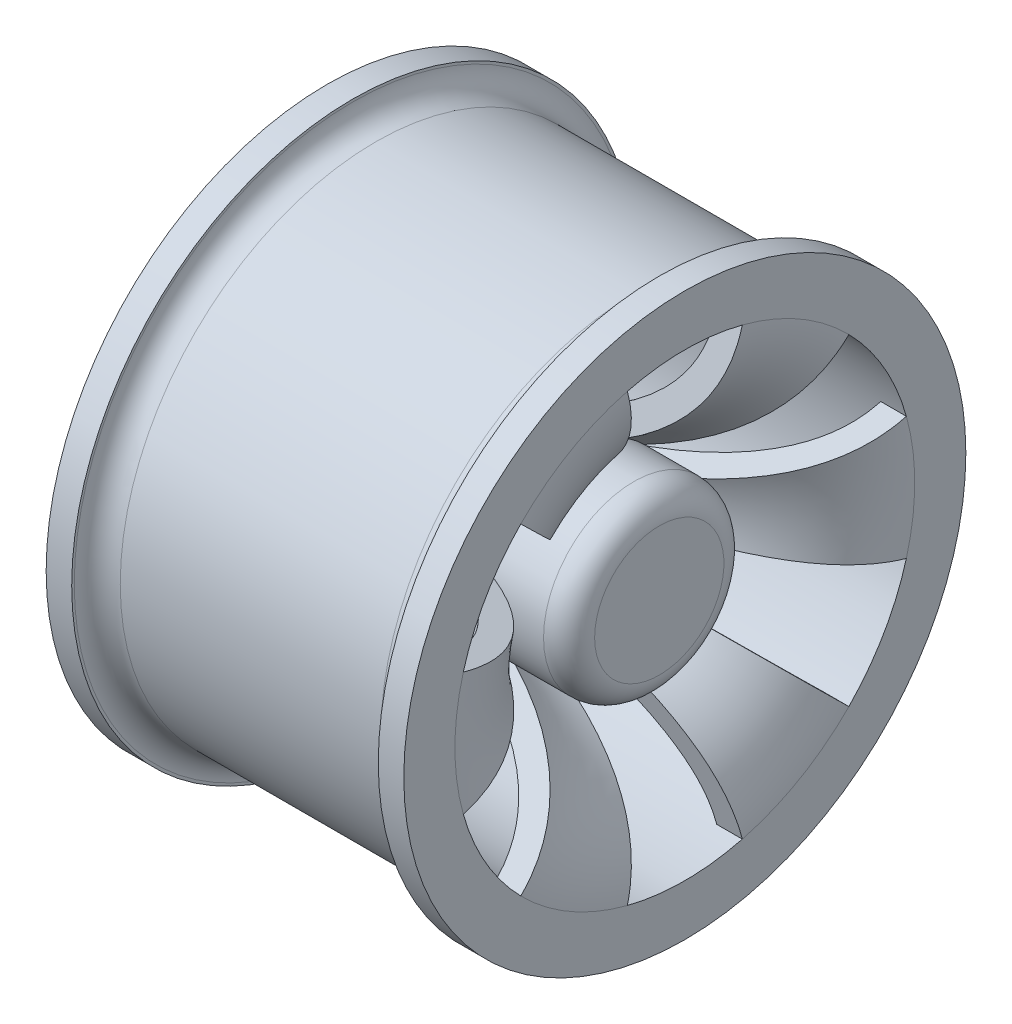
from build123d import *
from build123d.topology import SkipClean

# Parameters (mm, degrees)
REVOLVE1_OUTLINE_W  = 1
REVOLVE1_OUTLINE_H  = 1
SKETCH2_R           = 3.530343639
SKETCH2_R_2         = 2.5
BOSS_EXTRUDE1_DEPTH = 13
BOSS_EXTRUDE2_START = -2
SKETCH3_R           = 3.530343639
BOSS_EXTRUDE2_DEPTH = 2
CUT_EXTRUDE1_DEPTH  = 21.928449536
CIRPATTERN1_COUNT   = 6
FILLET1_R           = 1


# Read off the part's stored shape, not the designer's step: Revolve1
with BuildPart() as part:
    # Revolve1 outline → Revolve1 (revolve)
    with BuildSketch(Plane.YX):
        with BuildLine():
            add(Edge.make_bspline(
                [(2.5, 0), (2.716234195, 0.906371087), (3.054671918, 1.91746682), (3.530343639, 2.883101851)],
                knots=[0, 0, 0, 0, 0.307599927, 0.307599927, 0.307599927, 0.307599927], degree=3))
            Line((2.5, 0), (3.530343639, 0))
            Line((3.530343639, 0), (3.530343639, 2.883101851))
        make_face()
        with BuildLine():
            add(Edge.make_bspline(
                [(3.530343639, 2.883101851), (4.125497218, 4.091290439), (4.935485854, 5.228311877), (5.989749537, 6)],
                knots=[0.307599927, 0.307599927, 0.307599927, 0.307599927, 0.692464509, 0.692464509, 0.692464509, 0.692464509], degree=3))
            Line((3.530343639, 2.883101851), (3.530343639, 0))
            add(Edge.make_bspline(
                [(9, 6), (8.813858726, 5.999997286), (8.43297149, 5.974351341), (7.749922349, 5.831183314), (6.653568172, 5.361217178), (5.311352408, 4.099132984), (4.3155593, 2.31932682), (3.78420775, 0.901212892), (3.601875729, 0.278067654), (3.530343639, 0)],
                knots=[0, 0, 0, 0, 0.0625, 0.125, 0.25, 0.5, 0.75, 0.875, 0.972909743, 0.972909743, 0.972909743, 0.972909743], degree=3))
            Line((9, 6), (5.989749537, 6))
        make_face()
        with BuildLine():
            add(Edge.make_bspline(
                [(5.989749537, 6), (6.832184813, 6.616636338), (7.830594626, 7), (9, 7)],
                knots=[0.692464509, 0.692464509, 0.692464509, 0.692464509, 1, 1, 1, 1], degree=3))
            Line((5.989749537, 6), (9, 6))
            Line((9, 6), (9, 7))
        make_face()
        Polygon((10, 6), (9, 6), (9, 0), (10, 0), (10, 5.1), align=None)
        with Locations((9.5, 6.5)):
            Rectangle(REVOLVE1_OUTLINE_W, REVOLVE1_OUTLINE_H)
        Polygon((10, 0), (9, 0), (9, -7), (10, -7), (10, -5.1), align=None)
        with BuildLine():
            Line((10.9, 6), (10, 6))
            Line((10, 6), (10, 5.1))
            ThreePointArc((10, 5.1), (10.263603897, 5.736396103), (10.9, 6))
        make_face()
        Polygon((10, 7), (10, 6), (10.9, 6), (11, 6), (11, 7), align=None)
        with BuildLine():
            Line((10, -5.1), (10, -7))
            Line((10, -7), (11, -7))
            Line((11, -7), (11, -6))
            Line((11, -6), (10.9, -6))
            ThreePointArc((10.9, -6), (10.263603897, -5.736396103), (10, -5.1))
        make_face()
    revolve(axis=Axis((0, 0, 0), (1, 0, 0)))

    # Sketch2 → Boss-Extrude1 (add)
    with BuildSketch(Plane.ZY.offset(7)):
        Circle(SKETCH2_R)
        Circle(SKETCH2_R_2, mode=Mode.SUBTRACT)
    extrude(amount=-BOSS_EXTRUDE1_DEPTH)

    # Sketch3 → Boss-Extrude2 (add)
    with BuildSketch(Plane(origin=(6, 0, 0), x_dir=(0, 0, -1), z_dir=(1, 0, 0)).offset(BOSS_EXTRUDE2_START)):
        with Locations(Location((0, 0, 0), (0, 0, 180))):
            Circle(SKETCH3_R)
    extrude(amount=BOSS_EXTRUDE2_DEPTH)

    # Sketch4 → Cut-Extrude1 (cut, through all)
    with SkipClean():  # the faces are left unmerged after this step: merging them gives an invalid solid
        with BuildSketch(Plane(origin=(7, 0, 0), x_dir=(0, 0, -1), z_dir=(1, 0, 0))):
            with BuildLine():
                Line((-0.88258591, 3.41824053), (-2.25, 8.714212529))
                ThreePointArc((-2.25, 8.714212529), (0, 9), (2.25, 8.714212529))
                Line((2.25, 8.714212529), (0.88258591, 3.41824053))
                ThreePointArc((0.88258591, 3.41824053), (0, 3.530343639), (-0.88258591, 3.41824053))
            make_face()
        cut_extrude1 = extrude(amount=-CUT_EXTRUDE1_DEPTH, mode=Mode.SUBTRACT)
    add(part.part.scale(1), mode=Mode.REPLACE)  # the faces are merged on a copy

    # CirPattern1: Cut-Extrude1 ×6 about axis
    with SkipClean():  # the faces are left unmerged after this step: merging them gives an invalid solid
        cirpattern1_axis = Axis((0, 0, 0), (1, 0, 0))
        for i in range(1, CIRPATTERN1_COUNT):
            add(cut_extrude1.rotate(cirpattern1_axis, i * 360 / CIRPATTERN1_COUNT), mode=Mode.SUBTRACT)
    add(part.part.scale(1), mode=Mode.REPLACE)  # the faces are merged on a copy

    # Fillet1
    fillet1_edges = [part.edges().sort_by_distance(p)[0] for p in [
        (6, 3.267738298, 1.336118492),
    ]]
    fillet(fillet1_edges, radius=FILLET1_R)


solid = part.part
